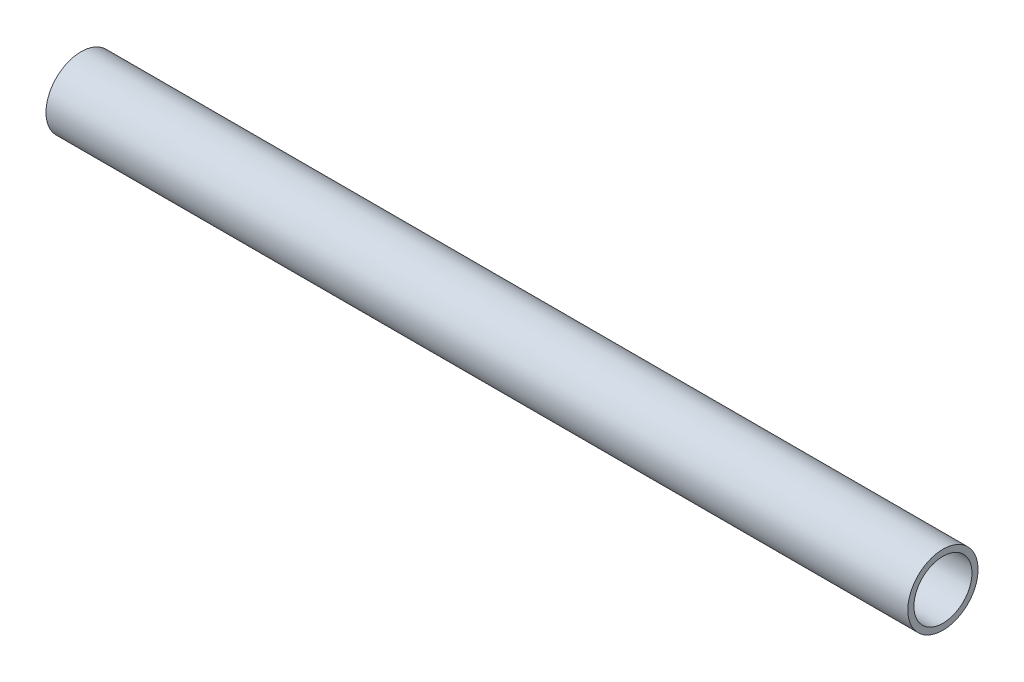
from build123d import *

# Parameters (mm, degrees)
SKETCH1_R           = 9.525
SKETCH1_R_2         = 7.874
BOSS_EXTRUDE1_DEPTH = 116.84


with BuildPart() as part:
    # Sketch1 → Boss-Extrude1 (new, symmetric)
    with BuildSketch(Plane(origin=(0, 0, 0), x_dir=(0, 0, -1), z_dir=(1, 0, 0))):
        Circle(SKETCH1_R)
        Circle(SKETCH1_R_2, mode=Mode.SUBTRACT)
    extrude(amount=BOSS_EXTRUDE1_DEPTH, both=True)


solid = part.part
